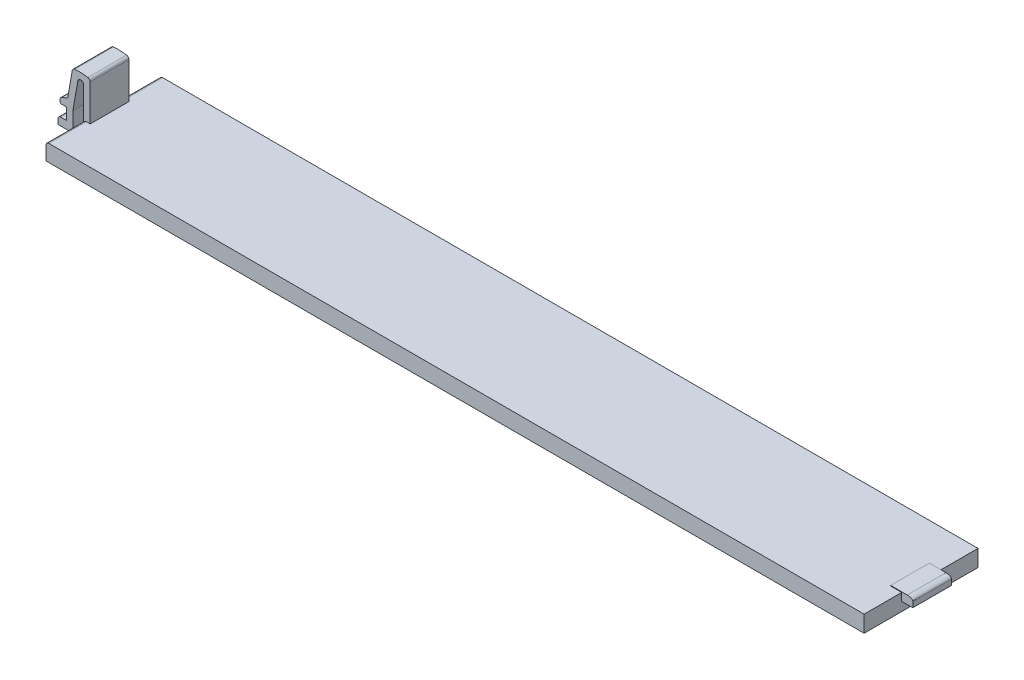
from build123d import *

# Parameters (mm, degrees)
SKETCH_1_W          = 148
SKETCH_1_H          = 20.6
EXTRUDE_1_DEPTH     = 3
EXTRUDE_START       = -1.4
SKETCH_2_W          = 4
SKETCH_2_H          = 7
EXTRUDE_2_DEPTH     = 1.5
EXTRUDE_START_2     = -10.3
EXTRUDE_4_DEPTH     = 3.5
FILLET_2_SIZE       = 1
FILLET_2_SIZE_2     = 0.5
CUT_EXTRUDE_1_REACH = 156.915
SKETCH_6_W          = 3
SKETCH_6_H          = 1.48026825
FILLET_3_R          = 0.5
FILLET_4_R          = 0.2


with BuildPart() as part:
    # 草图1 → 凸台-拉伸1 (new body)
    with BuildSketch(Plane(origin=(0, 0, 0), x_dir=(1, 0, 0), z_dir=(0, 1, 0))):
        Rectangle(SKETCH_1_W, SKETCH_1_H)
    extrude(amount=EXTRUDE_1_DEPTH)

    # 草图2 → 凸台-拉伸2 (add)
    with BuildSketch(Plane(origin=(0, 3, 0), x_dir=(1, 0, 0), z_dir=(0, 1, 0)).offset(EXTRUDE_START)):
        with Locations((74, 0)):
            Rectangle(SKETCH_2_W, SKETCH_2_H)
    extrude(amount=EXTRUDE_2_DEPTH)

    # 草图5 → 凸台-拉伸4 (add, symmetric)
    with BuildSketch(Plane.XY.offset(10.3).offset(EXTRUDE_START_2)):
        with BuildLine():
            Line((-74, 3), (-74, 9))
            ThreePointArc((-74, 9), (-74.480432289, 9.027171941), (-74.961629872, 9.02871601))
            Line((-74.961629872, 9.02871601), (-75.936491673, 3.5))
            Line((-75.936491673, 3.5), (-75.936491673, 0))
            Line((-75.936491673, 0), (-77.2, 0))
            Line((-77.2, 0), (-78.636491673, 0))
            Line((-78.636491673, 0), (-78.636491673, 1.4))
            Line((-78.636491673, 1.4), (-77.136491673, 1.4))
            Line((-77.136491673, 1.4), (-77.136491673, 3.5))
            Line((-77.136491673, 3.5), (-78.236491673, 3.5))
            Line((-78.236491673, 3.5), (-78.236491673, 4.5))
            Line((-78.236491673, 4.5), (-76.893992376, 4.98026825))
            Line((-76.893992376, 4.98026825), (-75.98900028, 10.112733474))
            ThreePointArc((-75.98900028, 10.112733474), (-74.390059228, 10.181991094), (-72.8, 10))
            Line((-72.8, 10), (-72.8, 3))
            Line((-72.8, 3), (-74, 3))
        make_face()
    extrude(amount=EXTRUDE_4_DEPTH, both=True)

    # 圆角2
    # an asymmetric fillet: 1, 0.5 mm, written as the material it takes off along each edge
    with BuildSketch(Plane(origin=(76, 3.1, -6), x_dir=(-1, 0, 0), z_dir=(0, 0, 1))) as fillet_2_piece_1:
        with BuildLine():
            Bezier((FILLET_2_SIZE, 0), (0, 0), (0, FILLET_2_SIZE_2), weights=[1, 0.707106781, 1])
            Line((0, FILLET_2_SIZE_2), (0, 0))
            Line((0, 0), (FILLET_2_SIZE, 0))
        make_face()
    extrude(amount=12, mode=Mode.SUBTRACT)

    # 切除-拉伸1: up to this plane
    cut_extrude_1_end = Plane(origin=(-61993.202735843, -351139.85584642, 3.5), z_dir=(0.984807753012209, -0.17364817766692522, 0))
    # 草图6 → 切除-拉伸1 (cut, up to the surface)
    with BuildSketch(Plane.ZY.offset(78.236491673), mode=Mode.PRIVATE) as cut_extrude_1_sk1:
        with Locations((0, 4.240134125)):
            Rectangle(SKETCH_6_W, SKETCH_6_H)
    cut_extrude_1_tool1 = split(extrude(cut_extrude_1_sk1.sketch, amount=-CUT_EXTRUDE_1_REACH, mode=Mode.PRIVATE), bisect_by=cut_extrude_1_end, keep=Keep.BOTH, mode=Mode.PRIVATE)
    add(cut_extrude_1_tool1.solids().sort_by_distance((-78.236492, 4.240134, 0))[0], mode=Mode.SUBTRACT)

    # 圆角3
    fillet_3_edges = [part.edges().sort_by_distance(p)[0] for p in [
        (-74, 3, -6.9),
        (-74, 3, 6.9),
        (-74.961629872, 9.02871601, 0),
        (-74, 9, 0),
        (-72.8, 10, 0),
        (-75.98900028, 10.112733474, 0),
        (-78.236491673, 4.5, 2.5),
        (-78.636491673, 1.4, 0),
        (-78.236491673, 4.5, -2.5),
    ]]
    fillet(fillet_3_edges, radius=FILLET_3_R)

    # 圆角4
    fillet_4_edges = [part.edges().sort_by_distance(p)[0] for p in [
        (-78.236491673, 3.5, 2.5),
        (-78.236491673, 3.5, -2.5),
    ]]
    fillet(fillet_4_edges, radius=FILLET_4_R)


solid = part.part
